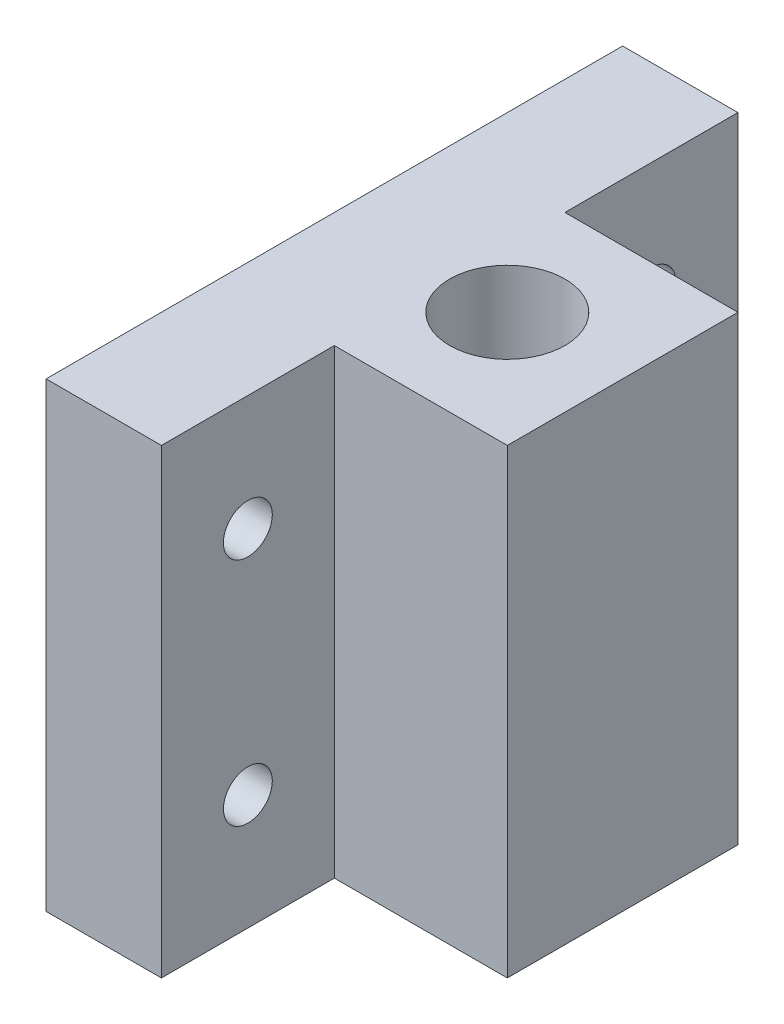
from build123d import *

# Parameters (mm, degrees)
SKETCH1_W           = 50
SKETCH1_H           = 40
BOSS_EXTRUDE1_DEPTH = 80
SKETCH4_W           = 100
SKETCH4_H           = 80
BOSS_EXTRUDE2_DEPTH = 20
SKETCH5_R           = 4.24
SCREW_HOLE_DEPTH    = 99.994949366
SKETCH6_R           = 8
ROD_HOLE_DEPTH      = 107.77078252
SKETCH7_R           = 10
CUT_EXTRUDE5_DEPTH  = 50
CHAMFER2_SIZE       = 2


with BuildPart() as part:
    # Sketch1 → Boss-Extrude1 (new body)
    with BuildSketch(Plane(origin=(0, 0, 0), x_dir=(1, 0, 0), z_dir=(0, 1, 0))):
        with Locations((25, 0)):
            Rectangle(SKETCH1_W, SKETCH1_H)
    extrude(amount=BOSS_EXTRUDE1_DEPTH)

    # Sketch4 → Boss-Extrude2 (add)
    with BuildSketch(Plane.ZY):
        with Locations((0, 40)):
            Rectangle(SKETCH4_W, SKETCH4_H)
    extrude(amount=-BOSS_EXTRUDE2_DEPTH)

    # Sketch5 → screw hole (cut, through all)
    with BuildSketch(Plane(origin=(20, 0, 0), x_dir=(0, 0, -1), z_dir=(1, 0, 0))):
        with Locations((-35, 20)):
            Circle(SKETCH5_R)
        with Locations((-35, 60)):
            Circle(SKETCH5_R)
    screw_hole = extrude(amount=-SCREW_HOLE_DEPTH, mode=Mode.SUBTRACT)

    # Mirror1: screw hole across plane
    add(screw_hole.mirror(Plane.XY), mode=Mode.SUBTRACT)

    # Sketch6 → rod hole (cut, through all)
    with BuildSketch(Plane(origin=(0, 80, 0), x_dir=(1, 0, 0), z_dir=(0, 1, 0))):
        with Locations(Location((30, 0, 0), (0, 0, 270))):
            Circle(SKETCH6_R)
    extrude(amount=-ROD_HOLE_DEPTH, mode=Mode.SUBTRACT)

    # Sketch7 → Cut-Extrude5 (cut)
    with BuildSketch(Plane(origin=(0, 80, 0), x_dir=(1, 0, 0), z_dir=(0, 1, 0))):
        with Locations(Location((30, 0, 0), (0, 0, 270))):
            Circle(SKETCH7_R)
    extrude(amount=-CUT_EXTRUDE5_DEPTH, mode=Mode.SUBTRACT)

    # Chamfer2
    chamfer2_edges = [part.edges().sort_by_distance(p)[0] for p in [
        (30, 30, -8),
    ]]
    chamfer(chamfer2_edges, length=CHAMFER2_SIZE - 0.0001)  # a hair under: the kernel refuses the full size


solid = part.part
